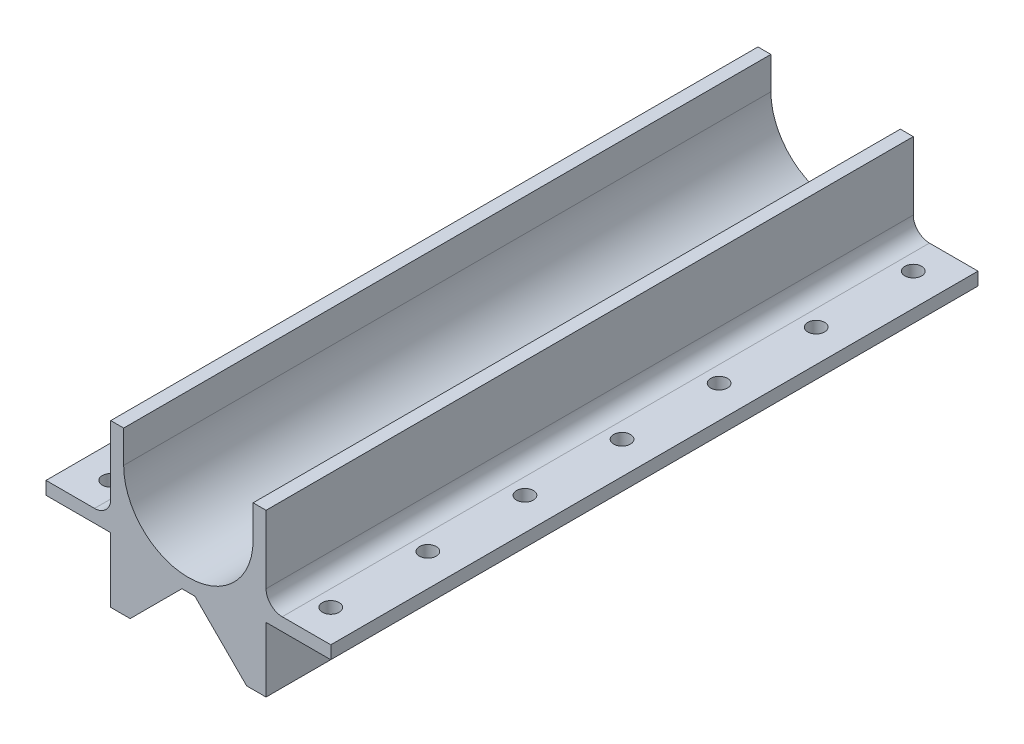
from build123d import *

# Parameters (mm, degrees)
BOSS_EXTRUDE1_DEPTH = 200
FILLET1_R           = 5
CHAMFER1_SIZE       = 18
SKETCH2_R           = 2.6
CUT_EXTRUDE1_DEPTH  = 207.968596652


with BuildPart() as part:
    # Sketch1 → Boss-Extrude1 (new body)
    with BuildSketch(Plane.XY):
        with BuildLine():
            Line((-20, 20), (-20, 30))
            Line((-20, 30), (-24, 30))
            Line((-24, 30), (-24, 4))
            Line((-24, 4), (-44, 4))
            Line((-44, 4), (-44, 0))
            Line((-44, 0), (-24, 0))
            Line((-24, 0), (-24, -20))
            Line((-24, -20), (-20, -20))
            Line((-20, -20), (-20, -4))
            Line((-20, -4), (20, -4))
            Line((20, -4), (20, -20))
            Line((20, -20), (24, -20))
            Line((24, -20), (24, 0))
            Line((24, 0), (44, 0))
            Line((44, 0), (44, 4))
            Line((44, 4), (24, 4))
            Line((24, 4), (24, 30))
            Line((24, 30), (20, 30))
            Line((20, 30), (20, 20))
            ThreePointArc((20, 20), (0, 0), (-20, 20))
        make_face()
    extrude(amount=BOSS_EXTRUDE1_DEPTH)

    # Fillet1
    fillet1_edges = [part.edges().sort_by_distance(p)[0] for p in [
        (24, 4, 100),
        (-24, 4, 100),
    ]]
    fillet(fillet1_edges, radius=FILLET1_R)

    # Chamfer1
    # the kernel refuses this chamfer: 18 mm, written as the material it adds along each edge
    with BuildSketch(Plane(origin=(20, -4, 0), x_dir=(-0.9996219169112966, 0.027495876610586365, 0), z_dir=(0, 0, 1))) as chamfer1_piece_1_section:
        Polygon((CHAMFER1_SIZE * 0.999621916911, CHAMFER1_SIZE * 0.0274958766106), (-CHAMFER1_SIZE * 0.0274958766106, CHAMFER1_SIZE * 0.999621916911), (0, 0), align=None)
    chamfer1_piece_1 = extrude(amount=200, mode=Mode.PRIVATE)
    chamfer1_piece_1 = split(chamfer1_piece_1, bisect_by=Plane(origin=(13.93765318, -20, 100), z_dir=(0, 1, 0)), keep=Keep.TOP, mode=Mode.PRIVATE)
    add(chamfer1_piece_1)
    with BuildSketch(Plane(origin=(-20, -4, 0), x_dir=(-0.027495876610586584, -0.9996219169112966, 0), z_dir=(0, 0, 1))) as chamfer1_piece_2_section:
        Polygon((CHAMFER1_SIZE * 0.999621916911, CHAMFER1_SIZE * 0.0274958766106), (-CHAMFER1_SIZE * 0.0274958766106, CHAMFER1_SIZE * 0.999621916911), (0, 0), align=None)
    chamfer1_piece_2 = extrude(amount=200, mode=Mode.PRIVATE)
    chamfer1_piece_2 = split(chamfer1_piece_2, bisect_by=Plane(origin=(-13.93765318, -20, 100), z_dir=(0, 1, 0)), keep=Keep.TOP, mode=Mode.PRIVATE)
    add(chamfer1_piece_2)

    # Sketch2 → Cut-Extrude1 (cut, through all)
    with BuildSketch(Plane.XZ):
        with Locations(Location((-34, 190, 0), (0, 0, 270))):
            Circle(SKETCH2_R)
        with Locations(Location((-34, 160, 0), (0, 0, 270))):
            Circle(SKETCH2_R)
        with Locations(Location((-34, 130, 0), (0, 0, 270))):
            Circle(SKETCH2_R)
        with Locations(Location((-34, 100, 0), (0, 0, 270))):
            Circle(SKETCH2_R)
        with Locations(Location((-34, 70, 0), (0, 0, 270))):
            Circle(SKETCH2_R)
        with Locations(Location((-34, 40, 0), (0, 0, 270))):
            Circle(SKETCH2_R)
        with Locations(Location((-34, 10, 0), (0, 0, 270))):
            Circle(SKETCH2_R)
        with Locations((34, 10)):
            Circle(SKETCH2_R)
        with Locations((34, 40)):
            Circle(SKETCH2_R)
        with Locations((34, 70)):
            Circle(SKETCH2_R)
        with Locations((34, 100)):
            Circle(SKETCH2_R)
        with Locations((34, 130)):
            Circle(SKETCH2_R)
        with Locations((34, 160)):
            Circle(SKETCH2_R)
        with Locations((34, 190)):
            Circle(SKETCH2_R)
    extrude(amount=-CUT_EXTRUDE1_DEPTH, mode=Mode.SUBTRACT)


solid = part.part
